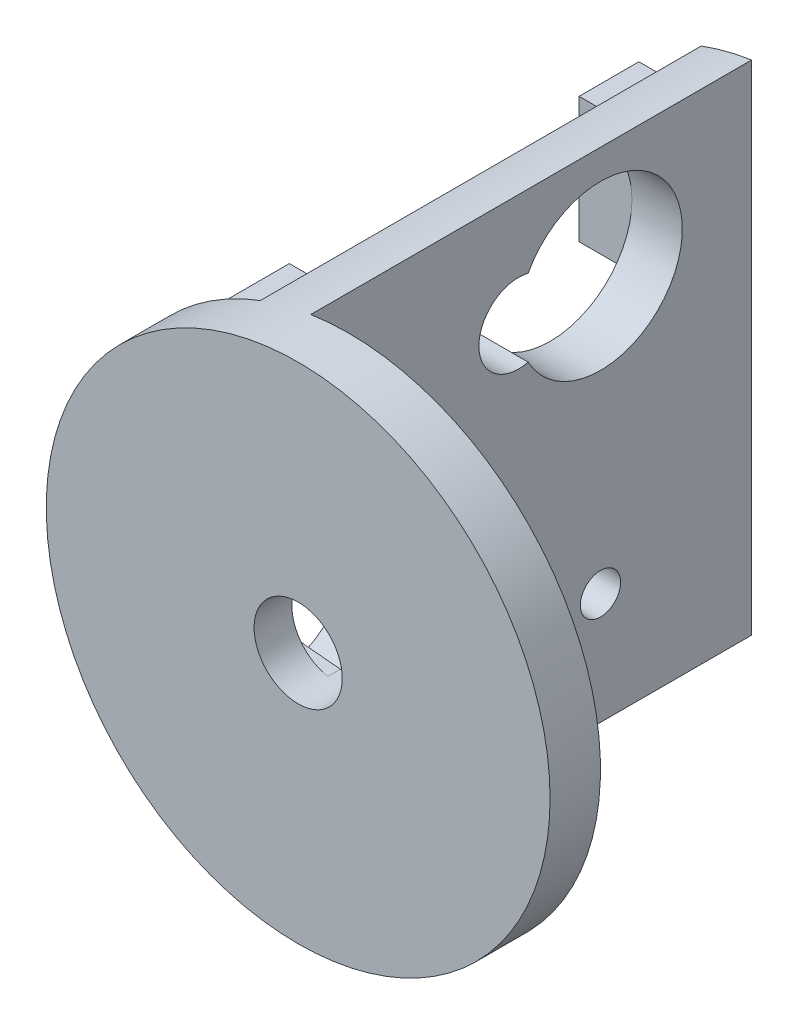
from build123d import *
from build123d.topology import SkipClean

# Parameters (mm, degrees)
ESBO_O1_R                = 20
RESSALTO_EXTRUS_O1_DEPTH = 4
RESSALTO_EXTRUS_O2_START = -3
ESBO_O2_R                = 3.5
RESSALTO_EXTRUS_O2_DEPTH = 3
RESSALTO_EXTRUS_O4_DEPTH = 35
ESBO_O4_R                = 1.6
CORTE_EXTRUS_O1_DEPTH    = 10
CORTE_EXTRUS_O3_DEPTH    = 8
ESBO_O10_W               = 6.5
ESBO_O10_H               = 10
ESBO_O10_R               = 0.75
ESBO_O10_W_2             = 4.75
RESSALTO_EXTRUS_O5_DEPTH = 4.2


# Read off the part's stored shape, not the designer's step: Ressalto-extrusão4
with BuildPart() as part:
    # Esboço1 → Ressalto-extrusão1 (new body)
    with BuildSketch(Plane.XY):
        Circle(ESBO_O1_R)
        with BuildLine():
            ThreePointArc((-16, -2), (-18, 0), (-16, 2))
            Line((-16, 2), (-0.65053243, 3.439012585))
            ThreePointArc((-0.65053243, 3.439012585), (-0.32669248, 3.484719791), (0, 3.5))
            ThreePointArc((0, 3.5), (0.32669248, 3.484719791), (0.65053243, 3.439012585))
            Line((0.65053243, 3.439012585), (16, 2))
            ThreePointArc((16, 2), (18, 0), (16, -2))
            Line((16, -2), (0.65053243, -3.439012585))
            ThreePointArc((0.65053243, -3.439012585), (0.32669248, -3.484719791), (0, -3.5))
            ThreePointArc((0, -3.5), (-0.32669248, -3.484719791), (-0.65053243, -3.439012585))
            Line((-0.65053243, -3.439012585), (-16, -2))
        make_face(mode=Mode.SUBTRACT)
    extrude(amount=RESSALTO_EXTRUS_O1_DEPTH)

    # Esboço2 → Ressalto-extrusão2 (add)
    with SkipClean():  # the faces are left unmerged after this step: merging them gives an invalid solid
        with BuildSketch(Plane.XY.offset(4).offset(RESSALTO_EXTRUS_O2_START)):
            with BuildLine():
                Line((-19.070572075, 6.026050177), (19.070572075, 6.026050177))
                ThreePointArc((19.070572075, 6.026050177), (20, 0), (19.070572075, -6.026050177))
                Line((19.070572075, -6.026050177), (-19.070572075, -6.026050177))
                ThreePointArc((-19.070572075, -6.026050177), (-20, 0), (-19.070572075, 6.026050177))
            make_face()
            with Locations(Location((0, 0, 0), (0, 0, 100.711650086))):
                Circle(ESBO_O2_R, mode=Mode.SUBTRACT)
        extrude(amount=RESSALTO_EXTRUS_O2_DEPTH)

    # Ressalto-extrusão4 outline → Ressalto-extrusão4 (add)
    with SkipClean():  # the faces are left unmerged after this step: merging them gives an invalid solid
        with BuildSketch(Plane(origin=(0, 0, 0), x_dir=(-1, 0, 0), z_dir=(0, 0, -1))):
            with BuildLine():
                ThreePointArc((3, -19.773719933), (5.026901421, -19.357950876), (7, -18.734993995))
                Line((7, -18.734993995), (7, 18.734993995))
                ThreePointArc((7, 18.734993995), (5.026901421, 19.357950876), (3, 19.773719933))
                Line((3, 19.773719933), (3, -19.773719933))
            make_face()
        extrude(amount=RESSALTO_EXTRUS_O4_DEPTH)

    # Esboço4 → Corte-extrusão1 (cut)
    with SkipClean():  # the faces are left unmerged after this step: merging them gives an invalid solid
        with BuildSketch(Plane(origin=(-3, 0, 0), x_dir=(0, 0, -1), z_dir=(1, 0, 0))):
            with Locations(Location((23, -10.925, 0), (0, 0, 90))):
                Circle(ESBO_O4_R)
            with BuildLine():
                ThreePointArc((17.263269231, 7.868871717), (29.5, 10.925), (17.263269231, 13.981128283))
                ThreePointArc((17.263269231, 13.981128283), (13.35, 10.925), (17.263269231, 7.868871717))
            make_face()
        extrude(amount=-CORTE_EXTRUS_O1_DEPTH, mode=Mode.SUBTRACT)

    # Esboço9 → Corte-extrusão3 (cut)
    with SkipClean():  # the faces are left unmerged after this step: merging them gives an invalid solid
        with BuildSketch(Plane.ZY.offset(7)):
            with BuildLine():
                Line((0, 8), (0, -8))
                ThreePointArc((0, -8), (-8, 0), (0, 8))
            make_face()
        extrude(amount=-CORTE_EXTRUS_O3_DEPTH, mode=Mode.SUBTRACT)

    # Esboço10 → Ressalto-extrusão5 (add)
    # profile 1 of 2: a face of its own
    with SkipClean():  # the faces are left unmerged after this step: merging them gives an invalid solid
        with BuildSketch(Plane.ZY.offset(7)):
            with Locations((-3.25, 10.925)):
                Rectangle(ESBO_O10_W, ESBO_O10_H)
            with Locations(Location((-4.25, 10.925, 0), (0, 0, 270))):
                Circle(ESBO_O10_R, mode=Mode.SUBTRACT)
        # profile 2 of 2: a face of its own
        with BuildSketch(Plane.ZY.offset(7)):
            with Locations((-31.875, 10.925)):
                Rectangle(ESBO_O10_W_2, ESBO_O10_H)
            with Locations(Location((-31.875, 10.925, 0), (0, 0, 270))):
                Circle(ESBO_O10_R, mode=Mode.SUBTRACT)
        extrude(amount=RESSALTO_EXTRUS_O5_DEPTH)


solid = part.part
